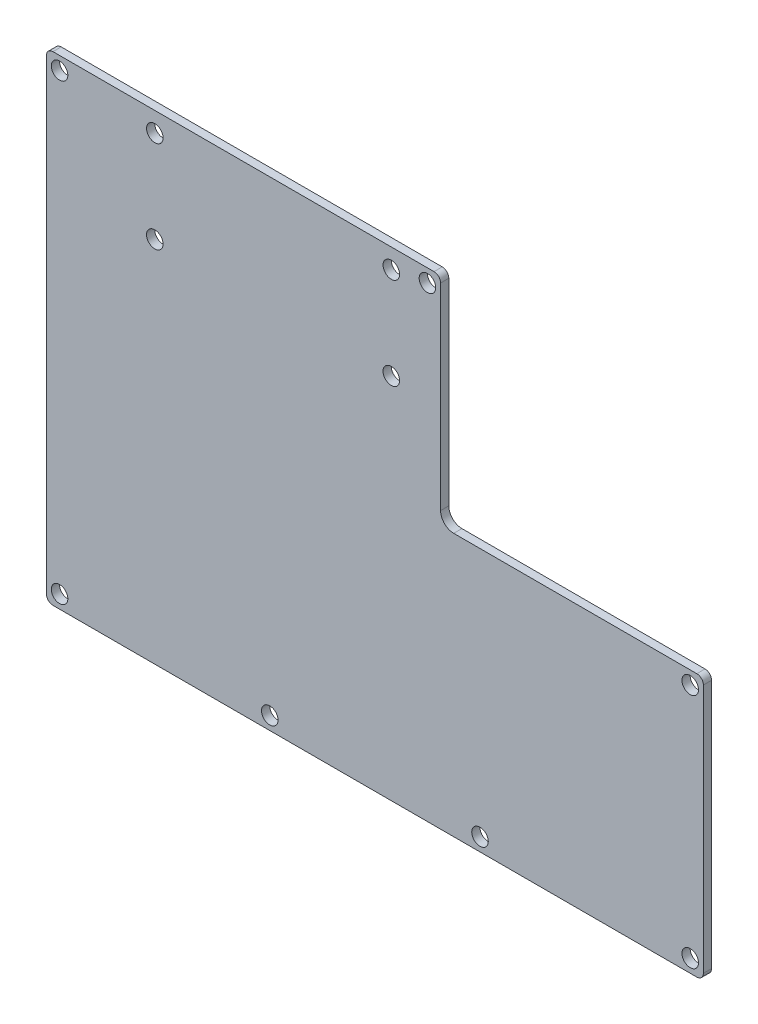
from build123d import *

# Parameters (mm, degrees)
MODEL_R             = 1.6
BOSS_EXTRUDE1_DEPTH = 1.5875


with BuildPart() as part:
    # Model → Boss-Extrude1 (new body)
    with BuildSketch(Plane.XY):
        with BuildLine():
            Line((127, 49.53), (127, 1.27))
            ThreePointArc((127, 1.27), (126.628025612, 0.371974388), (125.73, 0))
            Line((125.73, 0), (1.27, 0))
            ThreePointArc((1.27, 0), (0.371974388, 0.371974388), (0, 1.27))
            Line((0, 1.27), (0, 91.44))
            ThreePointArc((0, 91.44), (0.371974388, 92.338025612), (1.27, 92.71))
            Line((1.27, 92.71), (74.93, 92.71))
            ThreePointArc((74.93, 92.71), (75.828025612, 92.338025612), (76.2, 91.44))
            Line((76.2, 91.44), (76.2, 53.34))
            ThreePointArc((76.2, 53.34), (76.943948776, 51.543948776), (78.74, 50.8))
            Line((78.74, 50.8), (125.73, 50.8))
            ThreePointArc((125.73, 50.8), (126.628025612, 50.428025612), (127, 49.53))
        make_face()
        with Locations((2.54, 2.54)):
            Circle(MODEL_R, mode=Mode.SUBTRACT)
        with Locations((124.46, 2.54)):
            Circle(MODEL_R, mode=Mode.SUBTRACT)
        with Locations((2.54, 90.17)):
            Circle(MODEL_R, mode=Mode.SUBTRACT)
        with Locations((43.18, 2.54)):
            Circle(MODEL_R, mode=Mode.SUBTRACT)
        with Locations((83.82, 2.54)):
            Circle(MODEL_R, mode=Mode.SUBTRACT)
        with Locations((73.66, 90.17)):
            Circle(MODEL_R, mode=Mode.SUBTRACT)
        with Locations((124.46, 48.26)):
            Circle(MODEL_R, mode=Mode.SUBTRACT)
        with Locations((66.675, 88.9)):
            Circle(MODEL_R, mode=Mode.SUBTRACT)
        with Locations((20.955, 88.9)):
            Circle(MODEL_R, mode=Mode.SUBTRACT)
        with Locations((20.955, 71.12)):
            Circle(MODEL_R, mode=Mode.SUBTRACT)
        with Locations((66.675, 71.12)):
            Circle(MODEL_R, mode=Mode.SUBTRACT)
    extrude(amount=-BOSS_EXTRUDE1_DEPTH)


solid = part.part
